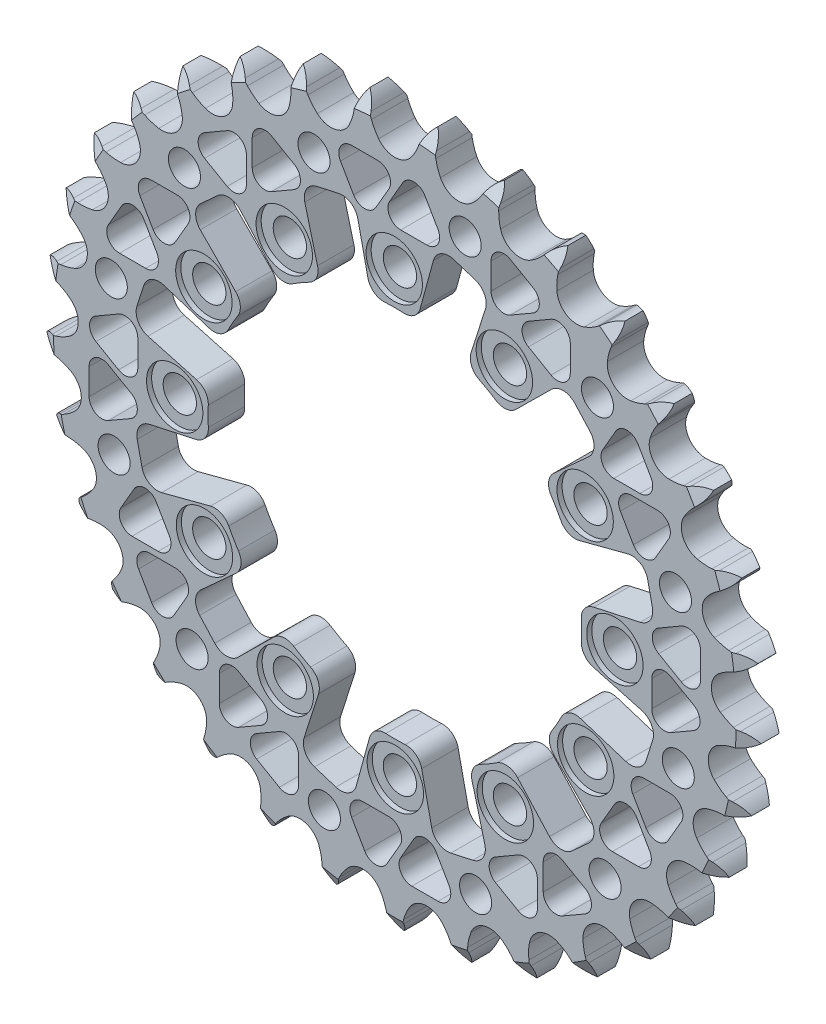
from build123d import *

# Parameters (mm, degrees)
EXTRUSION_DEPTH            = 7.2136
CIRPATTERN1_COUNT          = 12
CUT_EXTRUDE1_DEPTH         = 101.397293257
CUT_EXTRUDE1_DEPTH_BACK    = 101.397293257
SKETCH8_R                  = 37
CUT_EXTRUDE2_START         = 7.2136
SKETCH10_R                 = 5.588
CUT_EXTRUDE2_DEPTH         = 1.016
CIRPATTERN2_COUNT          = 12
CUT_EXTRUDE5_REACH         = 102.397
CIRPATTERN3_COUNT          = 12
CUT_EXTRUDE7_REACH         = 102.397
CIRPATTERN4_COUNT          = 12
FILLET1_R                  = 3.175
F_1_4_0_2500_DOWEL_HOLE1_D = 6.35
CIRPATTERN6_COUNT          = 12


with BuildPart() as part:
    # Teeth Sketch → Extrusion (new body)
    with BuildSketch(Plane.XY):
        with BuildLine():
            ThreePointArc((6.734552875, 70.527428506), (5.727412099, 69.369502295), (5.022388138, 68.006393031))
            Line((5.022388138, 68.006393031), (4.635162245, 66.971544668))
            ThreePointArc((4.635162245, 66.971544668), (4.0137299, 65.635158722), (3.209237245, 64.400291471))
            ThreePointArc((3.209237245, 64.400291471), (0, 62.793862006), (-3.209237245, 64.400291471))
            ThreePointArc((-3.209237245, 64.400291471), (-4.0137299, 65.635158722), (-4.635162245, 66.971544668))
            Line((-4.635162245, 66.971544668), (-5.022388138, 68.006393031))
            ThreePointArc((-5.022388138, 68.006393031), (-5.727412099, 69.369502295), (-6.734552875, 70.527428506))
            ThreePointArc((-6.734552875, 70.527428506), (-7.504354329, 69.199824885), (-7.938667464, 67.727922119))
            Line((-7.938667464, 67.727922119), (-8.123049341, 66.638491832))
            ThreePointArc((-8.123049341, 66.638491832), (-8.48033889, 65.208649276), (-9.036593151, 63.84384645))
            ThreePointArc((-9.036593151, 63.84384645), (-11.883816523, 61.659095115), (-15.339077445, 62.629142165))
            ThreePointArc((-15.339077445, 62.629142165), (-16.362732034, 63.68944252), (-17.22584699, 64.884071387))
            Line((-17.22584699, 64.884071387), (-17.801921547, 65.826935709))
            ThreePointArc((-17.801921547, 65.826935709), (-18.752174931, 67.031985151), (-19.960254337, 67.978383482))
            ThreePointArc((-19.960254337, 67.978383482), (-20.464893839, 66.529085505), (-20.61279894, 65.001587639))
            Line((-20.61279894, 65.001587639), (-20.587672758, 63.896950277))
            ThreePointArc((-20.587672758, 63.896950277), (-20.667906137, 62.425329346), (-20.955817525, 60.979918474))
            ThreePointArc((-20.955817525, 60.979918474), (-23.338120953, 58.295807876), (-26.914523421, 58.594412483))
            ThreePointArc((-26.914523421, 58.594412483), (-28.120342399, 59.441823925), (-29.193944743, 60.451518712))
            Line((-29.193944743, 60.451518712), (-29.938047129, 61.268321421))
            ThreePointArc((-29.938047129, 61.268321421), (-31.099185303, 62.271757414), (-32.464540202, 62.972422563))
            ThreePointArc((-32.464540202, 62.972422563), (-32.685778765, 61.453811636), (-32.541930156, 59.925926421))
            Line((-32.541930156, 59.925926421), (-32.308204042, 58.846006456))
            ThreePointArc((-32.308204042, 58.846006456), (-32.108481407, 57.385795366), (-32.117644055, 55.912017363))
            ThreePointArc((-32.117644055, 55.912017363), (-33.948924886, 52.825558252), (-37.517208396, 52.441928068))
            ThreePointArc((-37.517208396, 52.441928068), (-38.861610323, 53.045822938), (-40.106897269, 53.834090646))
            Line((-40.106897269, 53.834090646), (-40.992133685, 54.495310364))
            ThreePointArc((-40.992133685, 54.495310364), (-42.32219009, 55.260866117), (-43.795472998, 55.69047422))
            ThreePointArc((-43.795472998, 55.69047422), (-43.725314484, 54.157436897), (-43.294911229, 52.684386087))
            Line((-43.294911229, 52.684386087), (-42.861032653, 51.668214641))
            ThreePointArc((-42.861032653, 51.668214641), (-42.388572501, 50.272189225), (-42.118655247, 48.823310267))
            ThreePointArc((-42.118655247, 48.823310267), (-43.33272622, 45.446055318), (-46.763923708, 44.394055736))
            ThreePointArc((-46.763923708, 44.394055736), (-48.198318397, 44.732607702), (-49.570282031, 45.270958281))
            Line((-49.570282031, 45.270958281), (-50.564657725, 45.752696804))
            ThreePointArc((-50.564657725, 45.752696804), (-52.015560657, 46.252703137), (-53.543523293, 46.395727039))
            ThreePointArc((-53.543523293, 46.395727039), (-53.184503413, 44.903671283), (-52.483101407, 43.538694772))
            Line((-52.483101407, 43.538694772), (-51.864751871, 42.622998928))
            ThreePointArc((-51.864751871, 42.622998928), (-51.136630142, 41.341615182), (-50.597388499, 39.970001531))
            ThreePointArc((-50.597388499, 39.970001531), (-51.150369926, 36.424013535), (-54.320468976, 34.741666562))
            ThreePointArc((-54.320468976, 34.741666562), (-55.793013665, 34.802639473), (-57.242067645, 35.071615531))
            Line((-57.242067645, 35.071615531), (-58.309643291, 35.356461573))
            ThreePointArc((-58.309643291, 35.356461573), (-59.828953337, 35.572846956), (-61.356371149, 35.424117399))
            ThreePointArc((-61.356371149, 35.424117399), (-60.721465817, 34.026969994), (-59.774415556, 32.819401589))
            Line((-59.774415556, 32.819401589), (-58.993943824, 32.037276981))
            ThreePointArc((-58.993943824, 32.037276981), (-58.036476735, 30.916847451), (-57.2474003, 29.672072798))
            ThreePointArc((-57.2474003, 29.672072798), (-57.119305992, 26.085513002), (-59.913730964, 23.83362304))
            ThreePointArc((-59.913730964, 23.83362304), (-61.371204052, 23.614813176), (-62.844975793, 23.604693218))
            Line((-62.844975793, 23.604693218), (-63.947166423, 23.682351702))
            ThreePointArc((-63.947166423, 23.682351702), (-65.479971761, 23.607295402), (-66.951639889, 23.17218786))
            ThreePointArc((-66.951639889, 23.17218786), (-66.063796239, 21.920445353), (-64.905326586, 20.913929722))
            Line((-64.905326586, 20.913929722), (-63.99094094, 20.293644371))
            ThreePointArc((-63.99094094, 20.293644371), (-62.838733846, 19.374664301), (-61.828341898, 18.301718044))
            ThreePointArc((-61.828341898, 18.301718044), (-61.023801517, 14.804214063), (-63.341554612, 12.064170283))
            ThreePointArc((-63.341554612, 12.064170283), (-64.731279223, 11.573486003), (-66.176502774, 11.28463579))
            Line((-66.176502774, 11.28463579), (-67.273472348, 11.152299936))
            ThreePointArc((-67.273472348, 11.152299936), (-68.764373399, 10.788514683), (-70.127101923, 10.082755077))
            ThreePointArc((-70.127101923, 10.082755077), (-69.018408937, 9.021658703), (-67.690390004, 8.252573944))
            Line((-67.690390004, 8.252573944), (-66.675138724, 7.816546579))
            ThreePointArc((-66.675138724, 7.816546579), (-65.369835391, 7.132230303), (-64.174646128, 6.269891516))
            ThreePointArc((-64.174646128, 6.269891516), (-62.722737859, 2.987852256), (-64.480049441, -0.14131302))
            ThreePointArc((-64.480049441, -0.14131302), (-65.751797307, -0.886137108), (-67.116238523, -1.443277777))
            Line((-67.116238523, -1.443277777), (-68.168339704, -1.780825007))
            ThreePointArc((-68.168339704, -1.780825007), (-69.563451418, -2.420191065), (-70.767987779, -3.371094744))
            ThreePointArc((-70.767987779, -3.371094744), (-69.478516511, -4.203194198), (-68.028946362, -4.707051357))
            Line((-68.028946362, -4.707051357), (-66.949523274, -4.943061572))
            ThreePointArc((-66.949523274, -4.943061572), (-65.538300765, -5.367981082), (-64.201511441, -5.988545228))
            ThreePointArc((-64.201511441, -5.988545228), (-62.154711032, -8.936498316), (-63.288067282, -12.341688903))
            ThreePointArc((-63.288067282, -12.341688903), (-64.395874122, -13.313732915), (-65.630218543, -14.119027525))
            Line((-65.630218543, -14.119027525), (-66.599425651, -14.649586294))
            ThreePointArc((-66.599425651, -14.649586294), (-67.848325057, -15.541424803), (-68.851134172, -16.703104419))
            ThreePointArc((-68.851134172, -16.703104419), (-67.427489473, -17.276132709), (-65.908759351, -17.496551559))
            Line((-65.908759351, -17.496551559), (-64.804177617, -17.524014599))
            ThreePointArc((-64.804177617, -17.524014599), (-63.338041192, -17.674179644), (-61.907966855, -18.030540344))
            ThreePointArc((-61.907966855, -18.030540344), (-59.340251006, -20.537860555), (-59.808689476, -24.096003993))
            ThreePointArc((-59.808689476, -24.096003993), (-60.712516265, -25.260135726), (-61.772151467, -26.284478831))
            Line((-61.772151467, -26.284478831), (-62.623434833, -26.988873364))
            ThreePointArc((-62.623434833, -26.988873364), (-63.680983452, -28.100950955), (-64.445821187, -29.43142038))
            ThreePointArc((-64.445821187, -29.43142038), (-62.939457285, -29.724666771), (-61.406458053, -29.6536808))
            Line((-61.406458053, -29.6536808), (-60.316640136, -29.471604079))
            ThreePointArc((-60.316640136, -29.471604079), (-58.848579784, -29.341587304), (-57.376907048, -29.420864754))
            ThreePointArc((-57.376907048, -29.420864754), (-54.381079699, -31.396931003), (-54.167669802, -34.979426717))
            ThreePointArc((-54.167669802, -34.979426717), (-54.834849884, -36.293571418), (-55.681477891, -37.499940589))
            Line((-55.681477891, -37.499940589), (-56.384069915, -38.352712231))
            ThreePointArc((-56.384069915, -38.352712231), (-57.212045185, -39.644835523), (-57.711268312, -41.096008126))
            ThreePointArc((-57.711268312, -41.096008126), (-56.176629123, -41.09887393), (-54.684767369, -40.739048756))
            Line((-54.684767369, -40.739048756), (-53.649102126, -40.354013001))
            ThreePointArc((-53.649102126, -40.354013001), (-52.232177374, -39.94851355), (-50.772096325, -39.747842457))
            ThreePointArc((-50.772096325, -39.747842457), (-47.456434483, -41.12123456), (-46.56888941, -44.598601821))
            ThreePointArc((-46.56888941, -44.598601821), (-46.975309158, -46.015262876), (-47.578330627, -47.360056788))
            Line((-47.578330627, -47.360056788), (-48.106837804, -48.330384151))
            ThreePointArc((-48.106837804, -48.330384151), (-48.675314541, -49.755852442), (-48.890879835, -51.275279063))
            ThreePointArc((-48.890879835, -51.275279063), (-47.383431219, -50.987660703), (-45.986626711, -50.352001344))
            Line((-45.986626711, -50.352001344), (-45.042545785, -49.777922752))
            ThreePointArc((-45.042545785, -49.777922752), (-43.727967985, -49.111596431), (-42.332249756, -48.638229571))
            ThreePointArc((-42.332249756, -48.638229571), (-38.816590078, -49.35930956), (-37.28698802, -52.605867255))
            ThreePointArc((-37.28698802, -52.605867255), (-37.417958367, -54.073842843), (-37.75557853, -55.50845714))
            Line((-37.75557853, -55.50845714), (-38.090899233, -56.561270064))
            ThreePointArc((-38.090899233, -56.561270064), (-38.379331208, -58.068563217), (-38.303447577, -59.601327819))
            ThreePointArc((-38.303447577, -59.601327819), (-36.877672653, -59.03362057), (-35.626409548, -58.145101414))
            Line((-35.626409548, -58.145101414), (-34.808034481, -57.402728679))
            ThreePointArc((-34.808034481, -57.402728679), (-33.6433159, -56.499658259), (-32.362405386, -55.770704343))
            ThreePointArc((-32.362405386, -55.770704343), (-28.773812973, -55.813410509), (-26.657437732, -58.711819583))
            ThreePointArc((-26.657437732, -58.711819583), (-26.508225068, -60.178053241), (-26.568241455, -61.650637225))
            Line((-26.568241455, -61.650637225), (-26.69825632, -62.747884308))
            ThreePointArc((-26.69825632, -62.747884308), (-26.696218847, -64.28252482), (-26.331628924, -65.773229298))
            ThreePointArc((-26.331628924, -65.773229298), (-25.039058915, -64.94595158), (-23.978561119, -63.836686022))
            Line((-23.978561119, -63.836686022), (-23.31547012, -62.952850431))
            ThreePointArc((-23.31547012, -62.952850431), (-22.342706722, -61.845675228), (-21.222899365, -60.887480551))
            ThreePointArc((-21.222899365, -60.887480551), (-17.691075297, -60.250269381), (-15.06441819, -62.69577378))
            ThreePointArc((-15.06441819, -62.69577378), (-14.640415448, -64.107272002), (-14.42065891, -65.564602652))
            Line((-14.42065891, -65.564602652), (-14.340668861, -66.666626525))
            ThreePointArc((-14.340668861, -66.666626525), (-14.048235582, -68.17314849), (-13.408116596, -69.567914899))
            ThreePointArc((-13.408116596, -69.567914899), (-12.295468348, -68.510966685), (-11.464065017, -67.221046473))
            Line((-11.464065017, -67.221046473), (-10.980223921, -66.227692145))
            ThreePointArc((-10.980223921, -66.227692145), (-10.23457391, -64.956428358), (-9.316342465, -63.80362457))
            ThreePointArc((-9.316342465, -63.80362457), (-5.968936066, -62.509526537), (-2.926931324, -64.413739359))
            ThreePointArc((-2.926931324, -64.413739359), (-2.24346307, -65.719486924), (-1.751876179, -67.108892511))
            Line((-1.751876179, -67.108892511), (-1.464772265, -68.175863162))
            ThreePointArc((-1.464772265, -68.175863162), (-0.89251248, -69.59981695), (0, -70.848234798))
            ThreePointArc((0, -70.848234798), (0.89251248, -69.59981695), (1.464772265, -68.175863162))
            Line((1.464772265, -68.175863162), (1.751876179, -67.108892511))
            ThreePointArc((1.751876179, -67.108892511), (2.24346307, -65.719486924), (2.926931324, -64.413739359))
            ThreePointArc((2.926931324, -64.413739359), (5.968936066, -62.509526537), (9.316342465, -63.80362457))
            ThreePointArc((9.316342465, -63.80362457), (10.23457391, -64.956428358), (10.980223921, -66.227692145))
            Line((10.980223921, -66.227692145), (11.464065017, -67.221046473))
            ThreePointArc((11.464065017, -67.221046473), (12.295468348, -68.510966685), (13.408116596, -69.567914899))
            ThreePointArc((13.408116596, -69.567914899), (14.048235582, -68.17314849), (14.340668861, -66.666626525))
            Line((14.340668861, -66.666626525), (14.42065891, -65.564602652))
            ThreePointArc((14.42065891, -65.564602652), (14.640415448, -64.107272002), (15.06441819, -62.69577378))
            ThreePointArc((15.06441819, -62.69577378), (17.691075297, -60.250269381), (21.222899365, -60.887480551))
            ThreePointArc((21.222899365, -60.887480551), (22.342706722, -61.845675228), (23.31547012, -62.952850431))
            Line((23.31547012, -62.952850431), (23.978561119, -63.836686022))
            ThreePointArc((23.978561119, -63.836686022), (25.039058915, -64.94595158), (26.331628924, -65.773229298))
            ThreePointArc((26.331628924, -65.773229298), (26.696218847, -64.28252482), (26.69825632, -62.747884308))
            Line((26.69825632, -62.747884308), (26.568241455, -61.650637225))
            ThreePointArc((26.568241455, -61.650637225), (26.508225068, -60.178053241), (26.657437732, -58.711819583))
            ThreePointArc((26.657437732, -58.711819583), (28.773812973, -55.813410509), (32.362405386, -55.770704343))
            ThreePointArc((32.362405386, -55.770704343), (33.6433159, -56.499658259), (34.808034481, -57.402728679))
            Line((34.808034481, -57.402728679), (35.626409548, -58.145101414))
            ThreePointArc((35.626409548, -58.145101414), (36.877672653, -59.03362057), (38.303447577, -59.601327819))
            ThreePointArc((38.303447577, -59.601327819), (38.379331208, -58.068563217), (38.090899233, -56.561270064))
            Line((38.090899233, -56.561270064), (37.75557853, -55.50845714))
            ThreePointArc((37.75557853, -55.50845714), (37.417958367, -54.073842843), (37.28698802, -52.605867255))
            ThreePointArc((37.28698802, -52.605867255), (38.816590078, -49.35930956), (42.332249756, -48.638229571))
            ThreePointArc((42.332249756, -48.638229571), (43.727967985, -49.111596431), (45.042545785, -49.777922752))
            Line((45.042545785, -49.777922752), (45.986626711, -50.352001344))
            ThreePointArc((45.986626711, -50.352001344), (47.383431219, -50.987660703), (48.890879835, -51.275279063))
            ThreePointArc((48.890879835, -51.275279063), (48.675314541, -49.755852442), (48.106837804, -48.330384151))
            Line((48.106837804, -48.330384151), (47.578330627, -47.360056788))
            ThreePointArc((47.578330627, -47.360056788), (46.975309158, -46.015262876), (46.56888941, -44.598601821))
            ThreePointArc((46.56888941, -44.598601821), (47.456434483, -41.12123456), (50.772096325, -39.747842457))
            ThreePointArc((50.772096325, -39.747842457), (52.232177374, -39.94851355), (53.649102126, -40.354013001))
            Line((53.649102126, -40.354013001), (54.684767369, -40.739048756))
            ThreePointArc((54.684767369, -40.739048756), (56.176629123, -41.09887393), (57.711268312, -41.096008126))
            ThreePointArc((57.711268312, -41.096008126), (57.212045185, -39.644835523), (56.384069915, -38.352712231))
            Line((56.384069915, -38.352712231), (55.681477891, -37.499940589))
            ThreePointArc((55.681477891, -37.499940589), (54.834849884, -36.293571418), (54.167669802, -34.979426717))
            ThreePointArc((54.167669802, -34.979426717), (54.381079699, -31.396931003), (57.376907048, -29.420864754))
            ThreePointArc((57.376907048, -29.420864754), (58.848579784, -29.341587304), (60.316640136, -29.471604079))
            Line((60.316640136, -29.471604079), (61.406458053, -29.6536808))
            ThreePointArc((61.406458053, -29.6536808), (62.939457285, -29.724666771), (64.445821187, -29.43142038))
            ThreePointArc((64.445821187, -29.43142038), (63.680983452, -28.100950955), (62.623434833, -26.988873364))
            Line((62.623434833, -26.988873364), (61.772151467, -26.284478831))
            ThreePointArc((61.772151467, -26.284478831), (60.712516265, -25.260135726), (59.808689476, -24.096003993))
            ThreePointArc((59.808689476, -24.096003993), (59.340251006, -20.537860555), (61.907966855, -18.030540344))
            ThreePointArc((61.907966855, -18.030540344), (63.338041192, -17.674179644), (64.804177617, -17.524014599))
            Line((64.804177617, -17.524014599), (65.908759351, -17.496551559))
            ThreePointArc((65.908759351, -17.496551559), (67.427489473, -17.276132709), (68.851134172, -16.703104419))
            ThreePointArc((68.851134172, -16.703104419), (67.848325057, -15.541424803), (66.599425651, -14.649586294))
            Line((66.599425651, -14.649586294), (65.630218543, -14.119027525))
            ThreePointArc((65.630218543, -14.119027525), (64.395874122, -13.313732915), (63.288067282, -12.341688903))
            ThreePointArc((63.288067282, -12.341688903), (62.154711032, -8.936498316), (64.201511441, -5.988545228))
            ThreePointArc((64.201511441, -5.988545228), (65.538300765, -5.367981082), (66.949523274, -4.943061572))
            Line((66.949523274, -4.943061572), (68.028946362, -4.707051357))
            ThreePointArc((68.028946362, -4.707051357), (69.478516511, -4.203194198), (70.767987779, -3.371094744))
            ThreePointArc((70.767987779, -3.371094744), (69.563451418, -2.420191065), (68.168339704, -1.780825007))
            Line((68.168339704, -1.780825007), (67.116238523, -1.443277777))
            ThreePointArc((67.116238523, -1.443277777), (65.751797307, -0.886137108), (64.480049441, -0.14131302))
            ThreePointArc((64.480049441, -0.14131302), (62.722737859, 2.987852256), (64.174646128, 6.269891516))
            ThreePointArc((64.174646128, 6.269891516), (65.369835391, 7.132230303), (66.675138724, 7.816546579))
            Line((66.675138724, 7.816546579), (67.690390004, 8.252573944))
            ThreePointArc((67.690390004, 8.252573944), (69.018408937, 9.021658703), (70.127101923, 10.082755077))
            ThreePointArc((70.127101923, 10.082755077), (68.764373399, 10.788514683), (67.273472348, 11.152299936))
            Line((67.273472348, 11.152299936), (66.176502774, 11.28463579))
            ThreePointArc((66.176502774, 11.28463579), (64.731279223, 11.573486003), (63.341554612, 12.064170283))
            ThreePointArc((63.341554612, 12.064170283), (61.023801517, 14.804214063), (61.828341898, 18.301718044))
            ThreePointArc((61.828341898, 18.301718044), (62.838733846, 19.374664301), (63.99094094, 20.293644371))
            Line((63.99094094, 20.293644371), (64.905326586, 20.913929722))
            ThreePointArc((64.905326586, 20.913929722), (66.063796239, 21.920445353), (66.951639889, 23.17218786))
            ThreePointArc((66.951639889, 23.17218786), (65.479971761, 23.607295402), (63.947166423, 23.682351702))
            Line((63.947166423, 23.682351702), (62.844975793, 23.604693218))
            ThreePointArc((62.844975793, 23.604693218), (61.371204052, 23.614813176), (59.913730964, 23.83362304))
            ThreePointArc((59.913730964, 23.83362304), (57.119305992, 26.085513002), (57.2474003, 29.672072798))
            ThreePointArc((57.2474003, 29.672072798), (58.036476735, 30.916847451), (58.993943824, 32.037276981))
            Line((58.993943824, 32.037276981), (59.774415556, 32.819401589))
            ThreePointArc((59.774415556, 32.819401589), (60.721465817, 34.026969994), (61.356371149, 35.424117399))
            ThreePointArc((61.356371149, 35.424117399), (59.828953337, 35.572846956), (58.309643291, 35.356461573))
            Line((58.309643291, 35.356461573), (57.242067645, 35.071615531))
            ThreePointArc((57.242067645, 35.071615531), (55.793013665, 34.802639473), (54.320468976, 34.741666562))
            ThreePointArc((54.320468976, 34.741666562), (51.150369926, 36.424013535), (50.597388499, 39.970001531))
            ThreePointArc((50.597388499, 39.970001531), (51.136630142, 41.341615182), (51.864751871, 42.622998928))
            Line((51.864751871, 42.622998928), (52.483101407, 43.538694772))
            ThreePointArc((52.483101407, 43.538694772), (53.184503413, 44.903671283), (53.543523293, 46.395727039))
            ThreePointArc((53.543523293, 46.395727039), (52.015560657, 46.252703137), (50.564657725, 45.752696804))
            Line((50.564657725, 45.752696804), (49.570282031, 45.270958281))
            ThreePointArc((49.570282031, 45.270958281), (48.198318397, 44.732607702), (46.763923708, 44.394055736))
            ThreePointArc((46.763923708, 44.394055736), (43.33272622, 45.446055318), (42.118655247, 48.823310267))
            ThreePointArc((42.118655247, 48.823310267), (42.388572501, 50.272189225), (42.861032653, 51.668214641))
            Line((42.861032653, 51.668214641), (43.294911229, 52.684386087))
            ThreePointArc((43.294911229, 52.684386087), (43.725314484, 54.157436897), (43.795472998, 55.69047422))
            ThreePointArc((43.795472998, 55.69047422), (42.32219009, 55.260866117), (40.992133685, 54.495310364))
            Line((40.992133685, 54.495310364), (40.106897269, 53.834090646))
            ThreePointArc((40.106897269, 53.834090646), (38.861610323, 53.045822938), (37.517208396, 52.441928068))
            ThreePointArc((37.517208396, 52.441928068), (33.948924886, 52.825558252), (32.117644055, 55.912017363))
            ThreePointArc((32.117644055, 55.912017363), (32.108481407, 57.385795366), (32.308204042, 58.846006456))
            Line((32.308204042, 58.846006456), (32.541930156, 59.925926421))
            ThreePointArc((32.541930156, 59.925926421), (32.685778765, 61.453811636), (32.464540202, 62.972422563))
            ThreePointArc((32.464540202, 62.972422563), (31.099185303, 62.271757414), (29.938047129, 61.268321421))
            Line((29.938047129, 61.268321421), (29.193944743, 60.451518712))
            ThreePointArc((29.193944743, 60.451518712), (28.120342399, 59.441823925), (26.914523421, 58.594412483))
            ThreePointArc((26.914523421, 58.594412483), (23.338120953, 58.295807876), (20.955817525, 60.979918474))
            ThreePointArc((20.955817525, 60.979918474), (20.667906137, 62.425329346), (20.587672758, 63.896950277))
            Line((20.587672758, 63.896950277), (20.61279894, 65.001587639))
            ThreePointArc((20.61279894, 65.001587639), (20.464893839, 66.529085505), (19.960254337, 67.978383482))
            ThreePointArc((19.960254337, 67.978383482), (18.752174931, 67.031985151), (17.801921547, 65.826935709))
            Line((17.801921547, 65.826935709), (17.22584699, 64.884071387))
            ThreePointArc((17.22584699, 64.884071387), (16.362732034, 63.68944252), (15.339077445, 62.629142165))
            ThreePointArc((15.339077445, 62.629142165), (11.883816523, 61.659095115), (9.036593151, 63.84384645))
            ThreePointArc((9.036593151, 63.84384645), (8.48033889, 65.208649276), (8.123049341, 66.638491832))
            Line((8.123049341, 66.638491832), (7.938667464, 67.727922119))
            ThreePointArc((7.938667464, 67.727922119), (7.504354329, 69.199824885), (6.734552875, 70.527428506))
        make_face()
    extrude(amount=EXTRUSION_DEPTH)

    # Sketch7 → M6 Clearance Hole1 (revolve, cut)
    with BuildSketch(Plane(origin=(0, 43.500000122, 0), x_dir=(0, 1, 0), z_dir=(1, 0, 0))):
        Polygon((0, 0), (0, 19.254840043), (3.3, 17.272), (3.3, 0), align=None)
    m6_clearance_hole1 = revolve(axis=Axis((0, 43.500000122, -6.35), (0, 0, 1)), mode=Mode.SUBTRACT)

    # CirPattern1: M6 Clearance Hole1 ×12 about axis
    cirpattern1_axis = Axis((0, -0.110734981, 0), (0, 0, 1))
    for i in range(1, CIRPATTERN1_COUNT):
        add(m6_clearance_hole1.rotate(cirpattern1_axis, i * 360 / CIRPATTERN1_COUNT), mode=Mode.SUBTRACT)

    # Sketch8 → Cut-Extrude1 (cut, two sides: drawn at the far end of the back side and taken through both)
    with BuildSketch(Plane(origin=(0, 0, 0), x_dir=(-1, 0, 0), z_dir=(0, 0, -1)).offset(-CUT_EXTRUDE1_DEPTH_BACK)):
        Circle(SKETCH8_R)
    extrude(amount=CUT_EXTRUDE1_DEPTH + CUT_EXTRUDE1_DEPTH_BACK, mode=Mode.SUBTRACT)

    # Sketch5 → Cut-Revolve1 (revolve, cut)
    with BuildSketch(Plane(origin=(0, 0, 0), x_dir=(0, 0, -1), z_dir=(1, 0, 0))):
        Polygon((-7.2136, -67.654652666), (-7.2136, -70.848234798), (-5.3848, -70.848234798), align=None)
    cut_revolve1 = revolve(axis=Axis((0, 0, 7.2136), (0, 0, -1)), mode=Mode.SUBTRACT)

    # Mirror1: Cut-Revolve1 across plane
    add(cut_revolve1.mirror(Plane.XY.offset(3.6068)), mode=Mode.SUBTRACT)

    # Sketch10 → Cut-Extrude2 (cut)
    with BuildSketch(Plane.XY.offset(CUT_EXTRUDE2_START)):
        with Locations((-43.610735103, -0.110734981)):
            Circle(SKETCH10_R)
    cut_extrude2 = extrude(amount=-CUT_EXTRUDE2_DEPTH, mode=Mode.SUBTRACT)

    # CirPattern2: Cut-Extrude2 ×12 about axis
    cirpattern2_axis = Axis((0, 0, 0), (0, 0, 1))
    for i in range(1, CIRPATTERN2_COUNT):
        add(cut_extrude2.rotate(cirpattern2_axis, i * 360 / CIRPATTERN2_COUNT), mode=Mode.SUBTRACT)

    # Sketch12 → Cut-Extrude5 (cut, up to next)
    with BuildSketch(Plane.XY.offset(7.2136), mode=Mode.PRIVATE) as cut_extrude5_sk1:
        with BuildLine():
            Line((7.648603425, 48.917766415), (4.881542247, 38.826231413))
            ThreePointArc((4.881542247, 38.826231413), (5.184700305, 36.415175918), (7.103939114, 34.924667347))
            Line((7.103939114, 34.924667347), (10.968670613, 33.864972415))
            ThreePointArc((10.968670613, 33.864972415), (13.322211718, 34.13615413), (14.832810832, 35.96119812))
            Line((14.832810832, 35.96119812), (17.962452246, 45.762628084))
            ThreePointArc((17.962452246, 45.762628084), (17.759471863, 48.1841756), (15.903650388, 49.752939464))
            Line((15.903650388, 49.752939464), (11.676338654, 51.102739434))
            ThreePointArc((11.676338654, 51.102739434), (9.196626388, 50.868981567), (7.648603425, 48.917766415))
        make_face()
    cut_extrude5_tool1 = extrude(cut_extrude5_sk1.sketch, amount=-CUT_EXTRUDE5_REACH, mode=Mode.PRIVATE) & part.part
    cut_extrude5 = cut_extrude5_tool1.solids().sort_by_distance((11.359029, 42.508711, 7.2136))[0]
    add(cut_extrude5, mode=Mode.SUBTRACT)

    # CirPattern3: Cut-Extrude5 ×12 about axis
    cirpattern3_axis = Axis((0, 0, 0), (0, 0, 1))
    for i in range(1, CIRPATTERN3_COUNT):
        add(cut_extrude5.rotate(cirpattern3_axis, i * 360 / CIRPATTERN3_COUNT), mode=Mode.SUBTRACT)

    # Sketch13 → Cut-Extrude7 (cut, up to next)
    with BuildSketch(Plane.XY.offset(7.2136), mode=Mode.PRIVATE) as cut_extrude7_sk1:
        with BuildLine():
            Line((-10.753733117, 56.764296288), (-8.168142168, 52.285921397))
            ThreePointArc((-8.168142168, 52.285921397), (-5.968437642, 51.015921397), (-3.768733117, 52.285921397))
            Line((-3.768733117, 52.285921397), (-1.183142168, 56.764296288))
            ThreePointArc((-1.183142168, 56.764296288), (-1.183142168, 59.304296288), (-3.382846694, 60.574296288))
            Line((-3.382846694, 60.574296288), (-8.554028591, 60.574296288))
            ThreePointArc((-8.554028591, 60.574296288), (-10.753733117, 59.304296288), (-10.753733117, 56.764296288))
        make_face()
    cut_extrude7_tool1 = extrude(cut_extrude7_sk1.sketch, amount=-CUT_EXTRUDE7_REACH, mode=Mode.PRIVATE) & part.part
    # Sketch13 → Cut-Extrude7 (cut, up to next)
    with BuildSketch(Plane.XY.offset(7.2136), mode=Mode.PRIVATE) as cut_extrude7_sk2:
        with BuildLine():
            Line((-1.022061453, 54.730161284), (1.563529495, 59.208536174))
            ThreePointArc((1.563529495, 59.208536174), (3.763234021, 60.478536174), (5.962938547, 59.208536174))
            Line((5.962938547, 59.208536174), (8.548529495, 54.730161284))
            ThreePointArc((8.548529495, 54.730161284), (8.548529495, 52.190161284), (6.34882497, 50.920161284))
            Line((6.34882497, 50.920161284), (1.177643072, 50.920161284))
            ThreePointArc((1.177643072, 50.920161284), (-1.022061453, 52.190161284), (-1.022061453, 54.730161284))
        make_face()
    cut_extrude7_tool2 = extrude(cut_extrude7_sk2.sketch, amount=-CUT_EXTRUDE7_REACH, mode=Mode.PRIVATE) & part.part
    cut_extrude7_1 = cut_extrude7_tool1.solids().sort_by_distance((-5.968438, 56.541505, 7.2136))[0]
    add(cut_extrude7_1, mode=Mode.SUBTRACT)
    cut_extrude7_2 = cut_extrude7_tool2.solids().sort_by_distance((3.763234, 54.952953, 7.2136))[0]
    add(cut_extrude7_2, mode=Mode.SUBTRACT)
    cut_extrude7 = cut_extrude7_1 + cut_extrude7_2  # Cut-Extrude7 as one shape, for the pattern or mirror that repeats it

    # CirPattern4: Cut-Extrude7 ×12 about axis
    cirpattern4_axis = Axis((0, 0, 0), (0, 0, 1))
    for i in range(1, CIRPATTERN4_COUNT):
        add(cut_extrude7.rotate(cirpattern4_axis, i * 360 / CIRPATTERN4_COUNT), mode=Mode.SUBTRACT)

    # Fillet1
    fillet1_edges = [part.edges().sort_by_distance(p)[0] for p in [
        (5.326980174, -36.614522832, 3.6068),
        (-5.062663022, -36.652004626, 3.6068),
        (22.920561572, -29.045616833, 3.6068),
        (13.941607525, -34.272898617, 3.6068),
        (29.210235595, -22.710397101, 3.6068),
        (34.372597007, -13.69396126, 3.6068),
        (36.652004626, -5.062663022, 3.6068),
        (36.614522832, 5.326980174, 3.6068),
        (29.045616833, 22.920561572, 3.6068),
        (34.272898617, 13.941607525, 3.6068),
        (-13.69396126, -34.372597007, 3.6068),
        (-22.710397101, -29.210235595, 3.6068),
        (-29.045616833, -22.920561572, 3.6068),
        (-34.272898617, -13.941607525, 3.6068),
        (-36.614522832, -5.326980174, 3.6068),
        (-36.652004626, 5.062663022, 3.6068),
        (-34.372597007, 13.69396126, 3.6068),
        (-29.210235595, 22.710397101, 3.6068),
        (-22.920561572, 29.045616833, 3.6068),
        (-5.326980174, 36.614522832, 3.6068),
        (-13.941607525, 34.272898617, 3.6068),
        (5.062663022, 36.652004626, 3.6068),
        (13.69396126, 34.372597007, 3.6068),
        (22.710397101, 29.210235595, 3.6068),
    ]]
    fillet(fillet1_edges, radius=FILLET1_R)

    # 1/4 (0.2500) Dowel Hole1 (through all)
    with Locations(Plane(origin=(13.941639442, 56.168746093, 7.2136), x_dir=(1, 0, 0), z_dir=(0, 0, 1))):
        with Locations((0, 0)):
            f_1_4_0_2500_dowel_hole1 = Hole(F_1_4_0_2500_DOWEL_HOLE1_D / 2)

    # CirPattern6: 1/4 (0.2500) Dowel Hole1 ×12 about axis
    cirpattern6_axis = Axis((0, 0, 0), (0, 0, 1))
    for i in range(1, CIRPATTERN6_COUNT):
        add(f_1_4_0_2500_dowel_hole1.rotate(cirpattern6_axis, i * 360 / CIRPATTERN6_COUNT), mode=Mode.SUBTRACT)


solid = part.part
